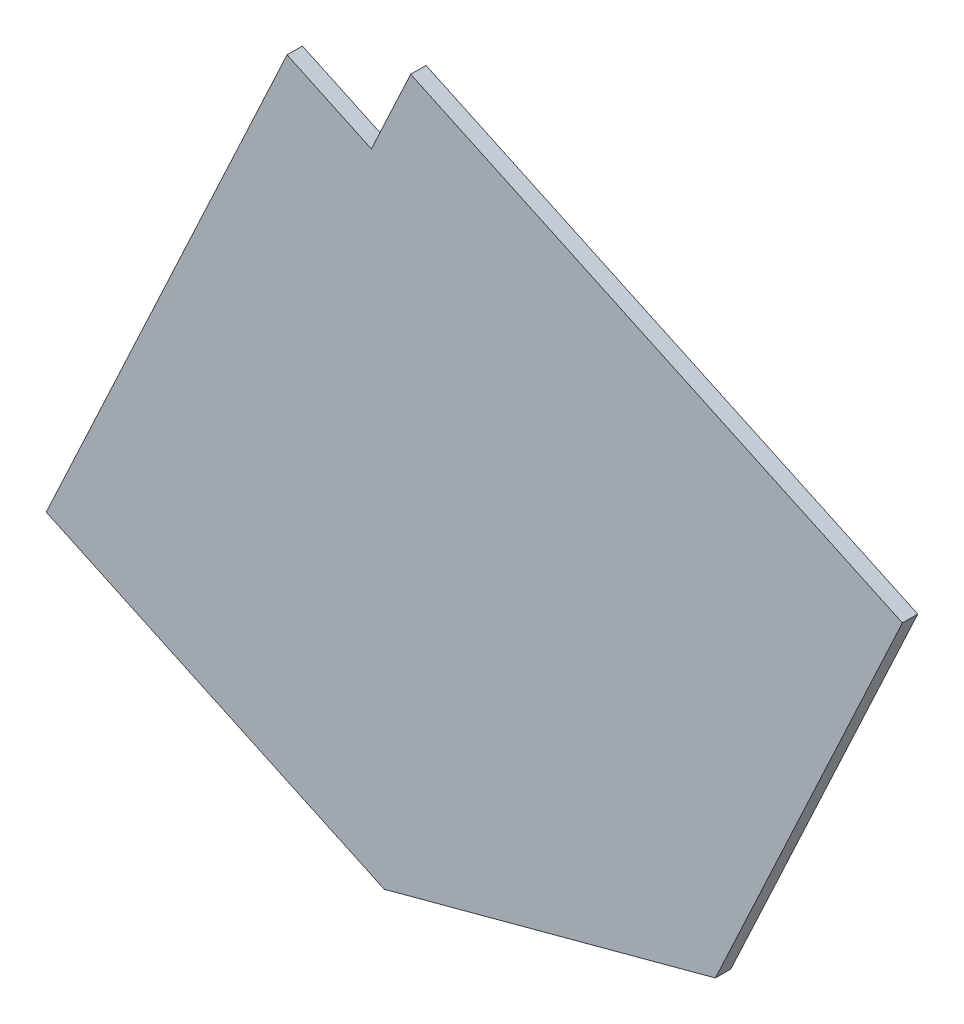
from build123d import *

# Parameters (mm, degrees)
BOSS_EXTRUDE1_DEPTH = 3.3


with BuildPart() as part:
    # Sketch1 → Boss-Extrude1 (new body)
    with BuildSketch(Plane.XY.offset(396.7)):
        Polygon((-337.548166916, -21.681678643), (-264.884837628, -55.565145558), (-193.682897035, -36.486643076), (-153.484392838, 49.719327367), (-259.198908878, 99.014815774), (-267.651274112, 80.888660034), (-285.777429853, 89.341025269), align=None)
    extrude(amount=-BOSS_EXTRUDE1_DEPTH)


solid = part.part
